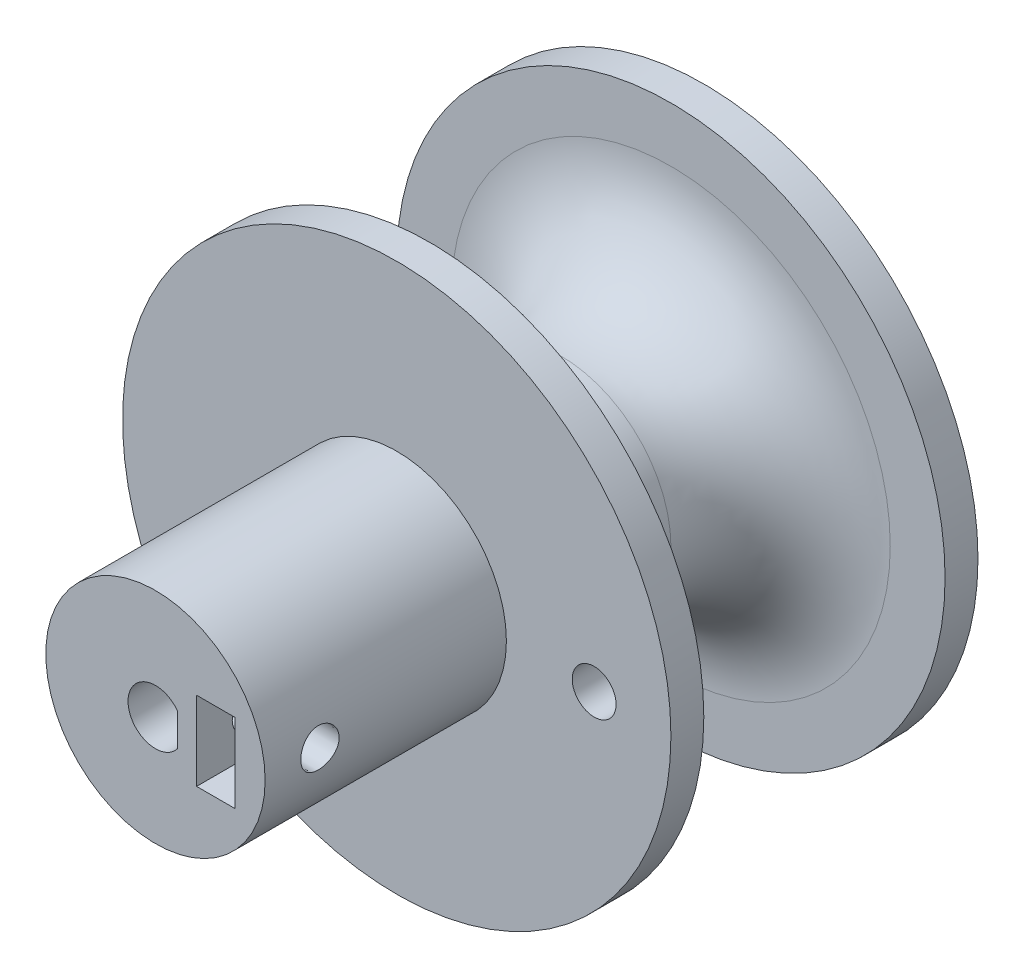
from build123d import *

# Parameters (mm, degrees)
CROQUIS1_R              = 10
SALIENTE_EXTRUIR2_DEPTH = 50
CROQUIS4_R              = 25
SALIENTE_EXTRUIR3_DEPTH = 3
SALIENTE_EXTRUIR4_START = 25
CROQUIS5_R              = 25
SALIENTE_EXTRUIR4_DEPTH = 3
REDONDEO2_R             = 10
CORTAR_EXTRUIR1_START   = 50
CORTAR_EXTRUIR1_DEPTH   = 20
CORTAR_EXTRUIR2_START   = 50
CROQUIS7_W              = 3.5
CROQUIS7_H              = 7.2
CORTAR_EXTRUIR2_DEPTH   = 10
CORTAR_EXTRUIR3_START   = 1.785357468
CORTAR_EXTRUIR3_DEPTH   = 8.214642632
CORTAR_EXTRUIR4_START   = 24.165153
CROQUIS9_R              = 2
CORTAR_EXTRUIR4_DEPTH   = 3.834847


# Read off the part's stored shape, not the designer's step: Cortar-Extruir3
with BuildPart() as part:
    # Croquis1 → Saliente-Extruir2 (new body)
    with BuildSketch(Plane.XY):
        Circle(CROQUIS1_R)
    extrude(amount=SALIENTE_EXTRUIR2_DEPTH)

    # Croquis4 → Saliente-Extruir3 (add)
    with BuildSketch(Plane.XY):
        Circle(CROQUIS4_R)
    extrude(amount=SALIENTE_EXTRUIR3_DEPTH)

    # Croquis5 → Saliente-Extruir4 (add)
    with BuildSketch(Plane.XY.offset(SALIENTE_EXTRUIR4_START)):
        Circle(CROQUIS5_R)
    extrude(amount=SALIENTE_EXTRUIR4_DEPTH)

    # Redondeo2
    redondeo2_edges = [part.edges().sort_by_distance(p)[0] for p in [
        (-10, 0, 25),
        (-10, 0, 3),
    ]]
    fillet(redondeo2_edges, radius=REDONDEO2_R)

    # Croquis6 → Cortar-Extruir1 (cut)
    with BuildSketch(Plane.XY.offset(CORTAR_EXTRUIR1_START)):
        with BuildLine():
            Line((2, 1.5), (2, -1.5))
            ThreePointArc((2, -1.5), (-2.5, 0), (2, 1.5))
        make_face()
    extrude(amount=-CORTAR_EXTRUIR1_DEPTH, mode=Mode.SUBTRACT)

    # Croquis7 → Cortar-Extruir2 (cut)
    with BuildSketch(Plane.XY.offset(CORTAR_EXTRUIR2_START)):
        with Locations((5.5, 0)):
            Rectangle(CROQUIS7_W, CROQUIS7_H)
    extrude(amount=-CORTAR_EXTRUIR2_DEPTH, mode=Mode.SUBTRACT)

    # Cortar-Extruir3 outline → Cortar-Extruir3 (cut)
    with BuildSketch(Plane(origin=(0, 0, 0), x_dir=(0, 0, -1), z_dir=(1, 0, 0)).offset(CORTAR_EXTRUIR3_START)):
        with BuildLine():
            add(Edge.make_bspline(
                [(-43.250000008, 0), (-43.250010298, 0.457042806), (-43.439269311, 0.91355666), (-44.08377392, 1.559232298), (-44.536167579, 1.749638189), (-45.461098225, 1.750360744), (-45.914256169, 1.560125471), (-46.558728463, 0.916635921), (-46.75, 0.463408547), (-46.75, -0.463408547), (-46.559497121, -0.915462774), (-45.915045576, -1.559741953), (-45.458501244, -1.749734355), (-44.543528816, -1.750265056), (-44.088756623, -1.563446648), (-43.437067231, -0.912124478), (-43.250180582, -0.457964068), (-43.250000045, -0.000460382), (-43.250000003, -0.000230191), (-43.250000008, 0)],
                knots=[0.500062925, 0.500062925, 0.500062925, 0.500062925, 0.625, 0.625, 0.750000001, 0.750000001, 0.875000002, 0.875000002, 1.000000004, 1.000000004, 1.125000006, 1.125000006, 1.250000009, 1.250000009, 1.375000013, 1.375000013, 1.500000015, 1.500000015, 1.50006294, 1.50006294, 1.50006294, 1.50006294], degree=3))
        make_face()
    extrude(amount=CORTAR_EXTRUIR3_DEPTH, mode=Mode.SUBTRACT)

    # Croquis9 → Cortar-Extruir4 (cut)
    with BuildSketch(Plane.XY.offset(CORTAR_EXTRUIR4_START)):
        with Locations((18, 0)):
            Circle(CROQUIS9_R)
    extrude(amount=CORTAR_EXTRUIR4_DEPTH, mode=Mode.SUBTRACT)


solid = part.part
